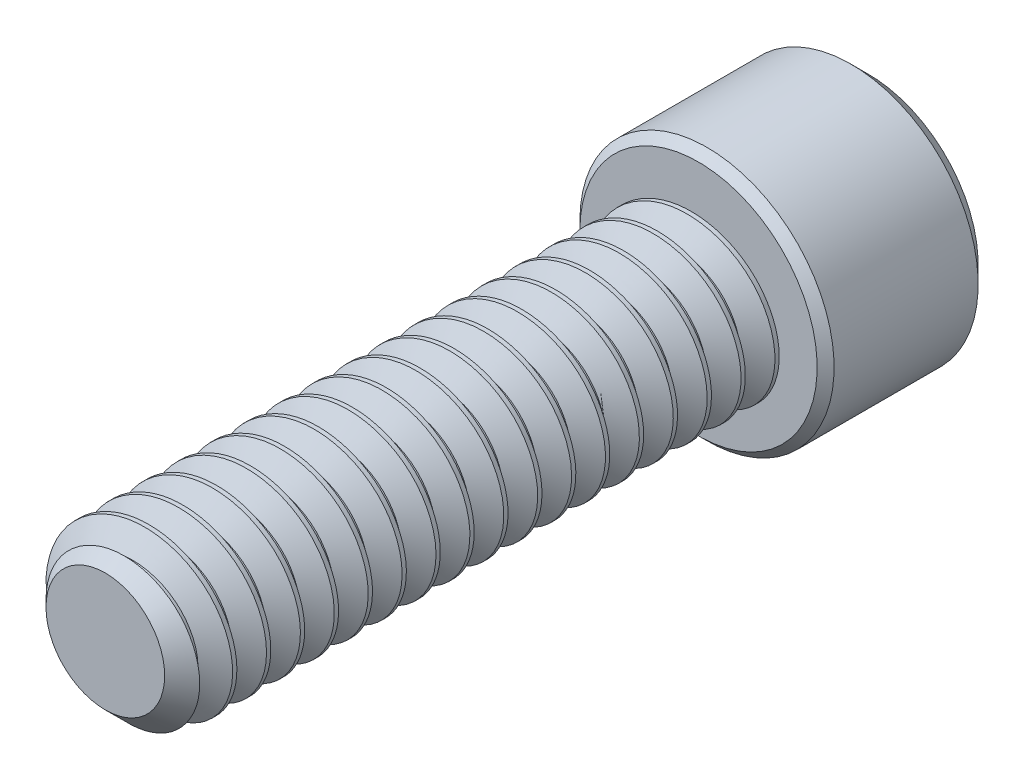
from build123d import *

# Parameters (mm, degrees)
SKETCH1_R          = 3.175
EXTRUDE1_DEPTH     = 22.225
CHAMFER3_SIZE      = 0.9525
CUT_SWEEP1_PITCH   = 1.27
SKETCH6_R          = 4.7625
EXTRUDE2_DEPTH     = 6.35
CUT_EXTRUDE1_DEPTH = 3.571875
SKETCH8_R          = 2.749630657
CUT_EXTRUDE2_DEPTH = 0.635
CUT_EXTRUDE2_DRAFT = -45
CHAMFER1_SIZE      = 0.635
CHAMFER2_SIZE      = 0.3175


with BuildPart() as part:
    # Sketch1 → Extrude1 (new body)
    with BuildSketch(Plane.XY):
        Circle(SKETCH1_R)
    extrude(amount=-EXTRUDE1_DEPTH)

    # Chamfer3
    chamfer3_edges = [part.edges().sort_by_distance(p)[0] for p in [
        (-3.175, 0, 0),
    ]]
    chamfer(chamfer3_edges, length=CHAMFER3_SIZE)

    # Cut-Sweep1: the profile of Sketch3 profile screwed along a right-hand helix of 18.5 turns, 6 arcs to a turn; built about Z, then put on its axis
    cut_sweep1_z = Axis((0, 0, 0), (0, 0, 1))
    cut_sweep1_corners = [(3.1753, 0, -1.111423205), (2.350110803, 0, -0.635), (2.350110803, 0, -0.47625), (3.1753, 0, 0.000173205)]
    with BuildLine(mode=Mode.PRIVATE) as cut_sweep1_profile:
        Line(cut_sweep1_corners[0], cut_sweep1_corners[1])
        Line(cut_sweep1_corners[1], cut_sweep1_corners[2])
        Line(cut_sweep1_corners[2], cut_sweep1_corners[3])
        Line(cut_sweep1_corners[3], cut_sweep1_corners[0])
    cut_sweep1_cap = Face(cut_sweep1_profile.wire())
    cut_sweep1_turn_angles = [0, 30, 60, 90, 120, 150, 180, 210, 240, 270, 300, 330, 360]
    cut_sweep1_turn_weights = [1, 0.8660254037844387, 1, 0.8660254037844387, 1, 0.8660254037844387, 1, 0.8660254037844387, 1, 0.8660254037844387, 1, 0.8660254037844387, 1]
    cut_sweep1_turn_rails = [Edge.make_bspline([Vector(p[0], p[1], 0).rotate(cut_sweep1_z, cut_sweep1_turn_angles[k]) / cut_sweep1_turn_weights[k] + Vector(0, 0, p[2] + CUT_SWEEP1_PITCH * cut_sweep1_turn_angles[k] / 360) for k in range(13)], [0, 0, 0, 1, 1, 2, 2, 3, 3, 4, 4, 5, 5, 6, 6, 6], 2, cut_sweep1_turn_weights) for p in cut_sweep1_corners]
    cut_sweep1_turn_sides = [Face.make_surface_from_curves(cut_sweep1_turn_rails[p[0]], cut_sweep1_turn_rails[p[1]]) for p in [(0, 1), (1, 2), (2, 3), (3, 0)]]
    cut_sweep1_last_angles = [6480, 6510, 6540, 6570, 6600, 6630, 6660]
    cut_sweep1_last_weights = [1, 0.8660254037844387, 1, 0.8660254037844387, 1, 0.8660254037843156, 1]
    cut_sweep1_last_rails = [Edge.make_bspline([Vector(p[0], p[1], 0).rotate(cut_sweep1_z, cut_sweep1_last_angles[k]) / cut_sweep1_last_weights[k] + Vector(0, 0, p[2] + CUT_SWEEP1_PITCH * cut_sweep1_last_angles[k] / 360) for k in range(7)], [0, 0, 0, 1, 1, 2, 2, 3, 3, 3], 2, cut_sweep1_last_weights) for p in cut_sweep1_corners]
    cut_sweep1_last_sides = [Face.make_surface_from_curves(cut_sweep1_last_rails[p[0]], cut_sweep1_last_rails[p[1]]) for p in [(0, 1), (1, 2), (2, 3), (3, 0)]]
    cut_sweep1 = Plane(origin=(0, 0, 0), x_dir=(0, 1, 0), z_dir=(0, 0, -1)) * Solid(Shell([*[p.moved(Location((0, 0, CUT_SWEEP1_PITCH * i))) for i in range(18) for p in cut_sweep1_turn_sides], *cut_sweep1_last_sides, cut_sweep1_cap, cut_sweep1_cap.rotate(cut_sweep1_z, 6660).moved(Location((0, 0, CUT_SWEEP1_PITCH * 6660 / 360)))]))
    add(cut_sweep1, mode=Mode.SUBTRACT)

    # Sketch6 → Extrude2 (add)
    with BuildSketch(Plane(origin=(0, 0, -22.225), x_dir=(-1, 0, 0), z_dir=(0, 0, -1))):
        Circle(SKETCH6_R)
    extrude(amount=EXTRUDE2_DEPTH)

    # Sketch7 → Cut-Extrude1 (cut)
    with BuildSketch(Plane(origin=(0, 0, -28.575), x_dir=(-1, 0, 0), z_dir=(0, 0, -1))):
        Polygon((0, 2.749630657), (-2.38125, 1.374815329), (-2.38125, -1.374815329), (0, -2.749630657), (2.38125, -1.374815329), (2.38125, 1.374815329), align=None)
    extrude(amount=-CUT_EXTRUDE1_DEPTH, mode=Mode.SUBTRACT)


with BuildPart() as cut_extrude2_tool:
    # Sketch8 → Cut-Extrude2 (with draft: the straight prism first)
    with BuildSketch(Plane(origin=(0, 0, -28.575), x_dir=(-1, 0, 0), z_dir=(0, 0, -1))):
        Circle(SKETCH8_R)
    extrude(amount=-CUT_EXTRUDE2_DEPTH)
    # Cut-Extrude2: the draft: its side faces are tilted about the plane it starts from
    cut_extrude2_sides = [cut_extrude2_tool.faces().sort_by_distance(p)[0] for p in [
        (2.749630657, 0, -28.2575),
    ]]
    draft(cut_extrude2_sides, Plane(origin=(0, 0, -28.575), x_dir=(-1, 0, 0), z_dir=(0, 0, -1)), CUT_EXTRUDE2_DRAFT)


with BuildPart() as part_1:
    add(part.part)

    # Cut-Extrude2: cut by cut_extrude2_tool
    add(cut_extrude2_tool.part, mode=Mode.SUBTRACT)

    # Chamfer1
    chamfer1_edges = [part_1.edges().sort_by_distance(p)[0] for p in [
        (4.7625, 0, -28.575),
    ]]
    chamfer(chamfer1_edges, length=CHAMFER1_SIZE)

    # Chamfer2
    chamfer2_edges = [part_1.edges().sort_by_distance(p)[0] for p in [
        (4.7625, 0, -22.225),
    ]]
    chamfer(chamfer2_edges, length=CHAMFER2_SIZE)


solid = part_1.part
